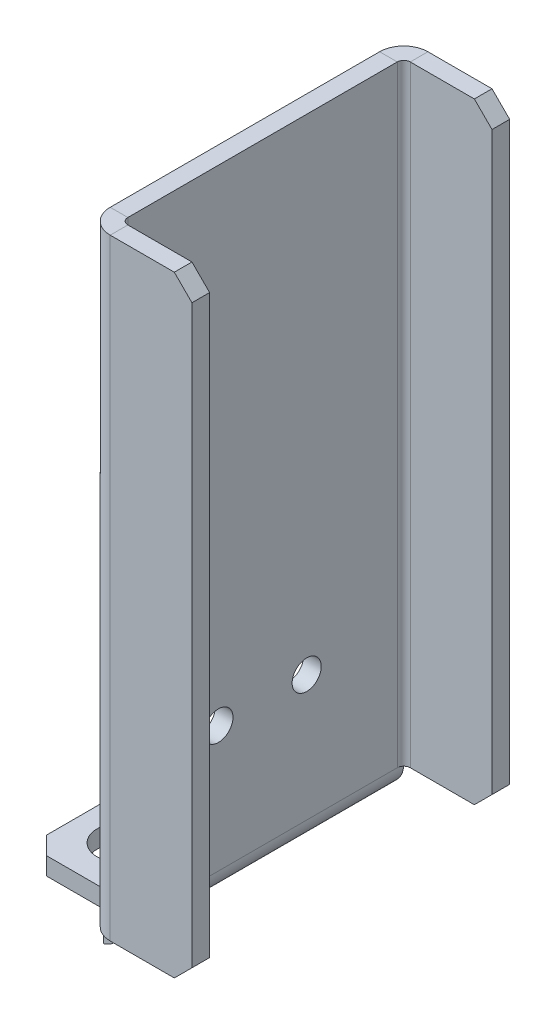
from build123d import *

# Parameters (mm, degrees)
SM_BASE_FLANGE_1_DEPTH             = 16
SKETCH_3_R                         = 2.75
CUT_EXTRUDE_1_DEPTH                = 73.801098893
SKETCH_4_W                         = 12
SKETCH_4_H                         = 3.5
CUT_EXTRUDE_2_DEPTH                = 75.726166769
SM_EDGE_FLANGE_1_STRIP_W           = 9.4732
SM_EDGE_FLANGE_1_STRIP_H           = 2
SM_EDGE_FLANGE_1_STRIP_CUT_DEPTH   = 69.2634
SM_EDGE_FLANGE_1_STRIP_2_W         = 9.4732
SM_EDGE_FLANGE_1_STRIP_2_H         = 2
SM_EDGE_FLANGE_1_STRIP_CUT_2_DEPTH = 69.2634
SM_EDGE_FLANGE_1_DEPTH             = 69.2634
SM_EDGE_FLANGE_1_BEND_DEPTH        = 69.2634
M4X0_7_1_D                         = 3.3
M4X0_7_1_DEPTH                     = 10.1
M4X0_7_1_TIP                       = 0.991420021
CHAMFER_1_SIZE                     = 2


# Sheet-metal steps are written as plain solids
with BuildPart() as part:
    # Sketch 1 → 基体-法兰1 (new, symmetric)
    with BuildSketch(Plane.XY):
        with BuildLine():
            Line((0, 70), (0, 0.7366))
            ThreePointArc((0, 0.7366), (-0.215745145, 0.215745145), (-0.7366, 0))
            Line((-0.7366, 0), (-12, 0))
            Line((-12, 0), (-12, -2))
            Line((-12, -2), (-0.7366, -2))
            ThreePointArc((-0.7366, -2), (1.198468417, -1.198468417), (2, 0.7366))
            Line((2, 0.7366), (2, 70))
            Line((2, 70), (0, 70))
        make_face()
    extrude(amount=SM_BASE_FLANGE_1_DEPTH, both=True)

    # 草图3 → 切除-拉伸1 (cut, through all)
    with BuildSketch(Plane(origin=(0, 0, 0), x_dir=(1, 0, 0), z_dir=(0, 1, 0))):
        with Locations(Location((-7, 7, 0), (0, 0, 270))):
            Circle(SKETCH_3_R)
        with Locations(Location((-7, -7, 0), (0, 0, 270))):
            Circle(SKETCH_3_R)
    extrude(amount=-CUT_EXTRUDE_1_DEPTH, mode=Mode.SUBTRACT)

    # 草图4 → 切除-拉伸2 (cut, through all)
    with BuildSketch(Plane(origin=(0, 70, 0), x_dir=(1, 0, 0), z_dir=(0, 1, 0))):
        with Locations((-6, 14.25)):
            Rectangle(SKETCH_4_W, SKETCH_4_H)
        with Locations((-6, -14.25)):
            Rectangle(SKETCH_4_W, SKETCH_4_H)
    extrude(amount=-CUT_EXTRUDE_2_DEPTH, mode=Mode.SUBTRACT)

    # 边线-法兰1 strip (across the edge) → 边线-法兰1 strip cut (cut)
    with BuildSketch(Plane(origin=(2, 70, 16), x_dir=(0, 0, -1), z_dir=(0, -1, 0))):
        with Locations((-4, -1)):
            Rectangle(SM_EDGE_FLANGE_1_STRIP_W, SM_EDGE_FLANGE_1_STRIP_H)
    extrude(amount=SM_EDGE_FLANGE_1_STRIP_CUT_DEPTH, mode=Mode.SUBTRACT)

    # 边线-法兰1 strip 2 (across the edge) → 边线-法兰1 strip cut 2 (cut)
    with BuildSketch(Plane(origin=(2, 0.7366, -16), x_dir=(0, 0, 1), z_dir=(0, 1, 0))):
        with Locations((-4, -1)):
            Rectangle(SM_EDGE_FLANGE_1_STRIP_2_W, SM_EDGE_FLANGE_1_STRIP_2_H)
    extrude(amount=SM_EDGE_FLANGE_1_STRIP_CUT_2_DEPTH, mode=Mode.SUBTRACT)

    # 边线-法兰1 section (across the edge) → 边线-法兰1 (add)
    with BuildSketch(Plane(origin=(2, 70, 16), x_dir=(0, 0, -1), z_dir=(0, -1, 0))):
        with BuildLine():
            Line((-2, 0.7366), (-2, 10))
            Line((-2, 10), (0, 10))
            Line((0, 10), (0, 0.7366))
            ThreePointArc((0, 0.7366), (0.215745145, 0.215745145), (0.7366, 0))
            Line((0.7366, 0), (0.7366, -2))
            ThreePointArc((0.7366, -2), (-1.198468417, -1.198468417), (-2, 0.7366))
        make_face()
    extrude(amount=SM_EDGE_FLANGE_1_DEPTH)

    # 边线-法兰1 section 2 (across the edge) → 边线-法兰1 bend (add)
    with BuildSketch(Plane(origin=(2, 0.7366, -16), x_dir=(0, 0, 1), z_dir=(0, 1, 0))):
        with BuildLine():
            Line((-2, 0.7366), (-2, 10))
            Line((-2, 10), (0, 10))
            Line((0, 10), (0, 0.7366))
            ThreePointArc((0, 0.7366), (0.215745145, 0.215745145), (0.7366, 0))
            Line((0.7366, 0), (0.7366, -2))
            ThreePointArc((0.7366, -2), (-1.198468417, -1.198468417), (-2, 0.7366))
        make_face()
    extrude(amount=SM_EDGE_FLANGE_1_BEND_DEPTH)

    # M4x0.7 螺纹孔1
    with Locations(Plane(origin=(2, 0, 0), x_dir=(0, 0, -1), z_dir=(1, 0, 0))):
        with Locations((-5, 15), (5, 15)):
            Hole(M4X0_7_1_D / 2, depth=M4X0_7_1_DEPTH)
            with Locations((0, 0, -(M4X0_7_1_DEPTH + M4X0_7_1_TIP / 2))):  # 118° drill point
                Cone(0, M4X0_7_1_D / 2, M4X0_7_1_TIP, mode=Mode.SUBTRACT)

    # 倒角1
    chamfer_1_edges = [part.edges().sort_by_distance(p)[0] for p in [
        (12, 70, 17),
        (12, 0.7366, 17),
        (12, 0.7366, -17),
        (12, 70, -17),
        (-12, -1, -12.5),
        (-12, -1, 12.5),
    ]]
    chamfer(chamfer_1_edges, length=CHAMFER_1_SIZE)


solid = part.part
